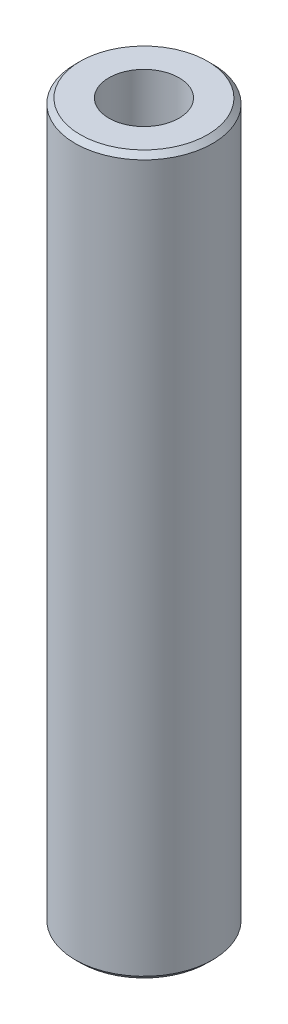
from build123d import *

# Parameters (mm, degrees)
SKETCH1_R           = 57.5
BOSS_EXTRUDE1_DEPTH = 600
SKETCH2_R           = 29.342449261
CUT_EXTRUDE1_DEPTH  = 606.485342515
CHAMFER1_SIZE       = 4.238588762


with BuildPart() as part:
    # Sketch1 → Boss-Extrude1 (new body)
    with BuildSketch(Plane(origin=(0, 0, 0), x_dir=(1, 0, 0), z_dir=(0, 1, 0))):
        Circle(SKETCH1_R)
    extrude(amount=BOSS_EXTRUDE1_DEPTH)

    # Sketch2 → Cut-Extrude1 (cut, through all)
    with BuildSketch(Plane(origin=(0, 0, 0), x_dir=(1, 0, 0), z_dir=(0, 1, 0))):
        Circle(SKETCH2_R)
    extrude(amount=CUT_EXTRUDE1_DEPTH, mode=Mode.SUBTRACT)

    # Chamfer1
    chamfer1_edges = [part.edges().sort_by_distance(p)[0] for p in [
        (-57.5, 600, 0),
        (-57.5, 0, 0),
    ]]
    chamfer(chamfer1_edges, length=CHAMFER1_SIZE)


solid = part.part
